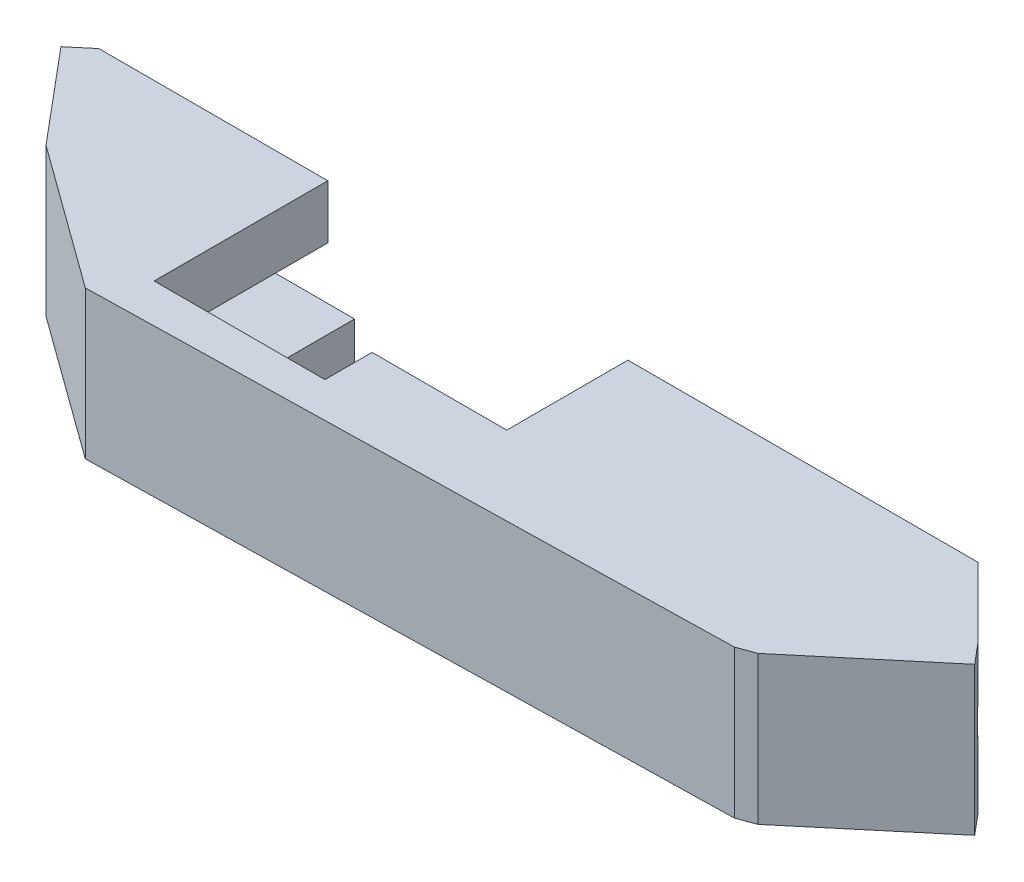
from build123d import *

# Parameters (mm, degrees)
SKETCH1_W                = 0.3
SKETCH1_H                = 0.3
BOSS_EXTRUDE1_DEPTH      = 4
SKETCH1_5_W              = 0.3
SKETCH1_5_H              = 0.3
BOSS_EXTRUDE2_DEPTH      = 4
BOSS_EXTRUDE3_DEPTH      = 3
BOSS_EXTRUDE4_DEPTH      = 4
BOSS_EXTRUDE4_DEPTH_BACK = 0.99800001


with BuildPart() as part:
    # Sketch1 → Boss-Extrude1 (new body)
    with BuildSketch(Plane(origin=(0, 0, 0), x_dir=(1, 0, 0), z_dir=(0, 1, 0))):
        Polygon((2.114911513, 12.894399988), (-14.885088487, 12.894399988), (-16.417177373, 11.608824769), (-10.632088886, 4.714424781), (0, -3), (47.2, -2), (48.485575219, -1.532088886), (57.239858961, 5.813627372), (55.954283741, 7.345716259), (50.8, 12.5), (24.8, 12.5), (24.8, 3.5), (14.8, 3.5), (14.8, 0), (2.114911513, 0), align=None)
        with Locations((-0.15, -0.15)):
            Rectangle(SKETCH1_W, SKETCH1_H, mode=Mode.SUBTRACT)
        Polygon((47.30919107, -0.3), (47.2, -0.3), (47.2, 0), (47.392836283, -0.229813333), align=None, mode=Mode.SUBTRACT)
    extrude(amount=BOSS_EXTRUDE1_DEPTH)

    # Sketch1<5> → Boss-Extrude2 (add)
    with BuildSketch(Plane(origin=(0, 0, 0), x_dir=(1, 0, 0), z_dir=(0, 1, 0))):
        with Locations((-0.15, -0.15)):
            Rectangle(SKETCH1_5_W, SKETCH1_5_H)
        Polygon((47.2, 0), (47.2, -0.3), (47.30919107, -0.3), (47.392836283, -0.229813333), align=None)
    extrude(amount=BOSS_EXTRUDE2_DEPTH)

    # Sketch1<6> → Boss-Extrude3 (add)
    with BuildSketch(Plane(origin=(0, 0, 0), x_dir=(1, 0, 0), z_dir=(0, 1, 0))):
        with BuildLine():
            Line((-0.3, -0.3), (-0.3, 4.117528082))
            ThreePointArc((-0.3, 4.117528082), (-0.885786438, 5.114213562), (-1.882471918, 5.7))
            Line((-1.882471918, 5.7), (-9.239892297, 5.7))
            Line((-9.239892297, 5.7), (-15.11490182, 12.701563705))
            Line((-15.11490182, 12.701563705), (-16.417177373, 11.608824769))
            Line((-16.417177373, 11.608824769), (-10.632088886, 4.714424781))
            Line((-10.632088886, 4.714424781), (0, -3))
            Line((0, -3), (47.2, -2))
            Line((47.2, -2), (48.485575219, -1.532088886))
            Line((48.485575219, -1.532088886), (57.239858961, 5.813627372))
            Line((57.239858961, 5.813627372), (56.147120024, 7.115902926))
            Line((56.147120024, 7.115902926), (47.30919107, -0.3))
            Line((47.30919107, -0.3), (38.858723672, -0.3))
            Line((38.858723672, -0.3), (38.858723672, 0.607136774))
            ThreePointArc((38.858723672, 0.607136774), (33.95, 4.199275448), (29.041276328, 0.607136774))
            Line((29.041276328, 0.607136774), (29.041276328, -0.3))
            Line((29.041276328, -0.3), (-0.3, -0.3))
        make_face()
    extrude(amount=-BOSS_EXTRUDE3_DEPTH)

    # Sketch2 → Boss-Extrude4 (add, two sides: drawn at the far end of the back side and taken through both)
    with BuildSketch(Plane(origin=(0, -3, 0), x_dir=(-1, 0, 0), z_dir=(0, -1, 0)).offset(-BOSS_EXTRUDE4_DEPTH_BACK)):
        Polygon((-55.954283741, 7.345716259), (-57.239858961, 5.813627372), (-48.485575219, -1.532088886), (-47.2, -2), (0, -3), (10.632088886, 4.714424781), (16.417177373, 11.608824769), (14.885088487, 12.894399988), (13.295498156, 11), (-6, 11), (-6, 5.000587023), (-21.8, 5.000587023), (-21.8, 11), (-51.796266659, 11), (-51.796266659, 3.856725658), align=None)
    extrude(amount=BOSS_EXTRUDE4_DEPTH + BOSS_EXTRUDE4_DEPTH_BACK)


solid = part.part
